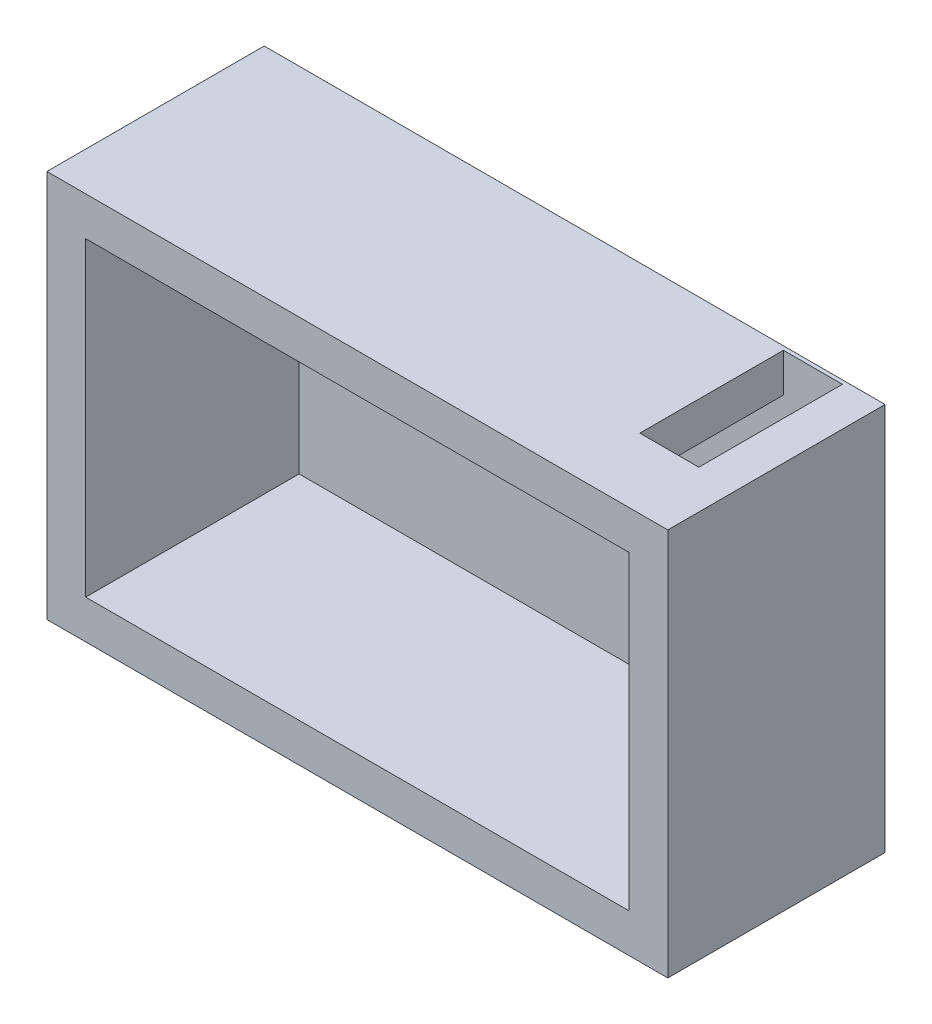
from build123d import *

# Parameters (mm, degrees)
BOSS_EXTRUDE1_DEPTH = 2.8
BOSS_EXTRUDE3_REACH = 10.847
SKETCH3_W           = 0.9
SKETCH3_H           = 0.5
BOSS_EXTRUDE5_REACH = 11.439
SKETCH5_W           = 0.05
SKETCH5_H           = 4.5


with BuildPart() as part:
    # Sketch1 → Boss-Extrude1 (new body)
    with BuildSketch(Plane.XY):
        Polygon((0, 0), (8, 0), (8, 5), (7.5, 5), (7.5, 0.5), (0.5, 0.5), (0.5, 4.5), (6.74, 4.5), (6.74, 5), (0, 5), align=None)
    extrude(amount=BOSS_EXTRUDE1_DEPTH)

    # Sketch3 → Boss-Extrude3 (add, up to next)
    with BuildSketch(Plane(origin=(6.74, 0, 0), x_dir=(0, 0, -1), z_dir=(1, 0, 0)), mode=Mode.PRIVATE) as boss_extrude3_sk1:
        with Locations((-2.35, 4.75)):
            Rectangle(SKETCH3_W, SKETCH3_H)
    boss_extrude3_tool1 = extrude(boss_extrude3_sk1.sketch, amount=BOSS_EXTRUDE3_REACH, mode=Mode.PRIVATE) - part.part
    add(boss_extrude3_tool1.solids().sort_by_distance((6.74, 4.75, 2.35))[0])

    # Sketch5 → Boss-Extrude5 (add, up to next)
    with BuildSketch(Plane(origin=(0.5, 0, 0), x_dir=(0, 0, -1), z_dir=(1, 0, 0)), mode=Mode.PRIVATE) as boss_extrude5_sk1:
        with Locations((-0.025, 2.75)):
            Rectangle(SKETCH5_W, SKETCH5_H)
    boss_extrude5_tool1 = extrude(boss_extrude5_sk1.sketch, amount=BOSS_EXTRUDE5_REACH, mode=Mode.PRIVATE) - part.part
    add(boss_extrude5_tool1.solids().sort_by_distance((0.5, 2.75, 0.025))[0])


solid = part.part
